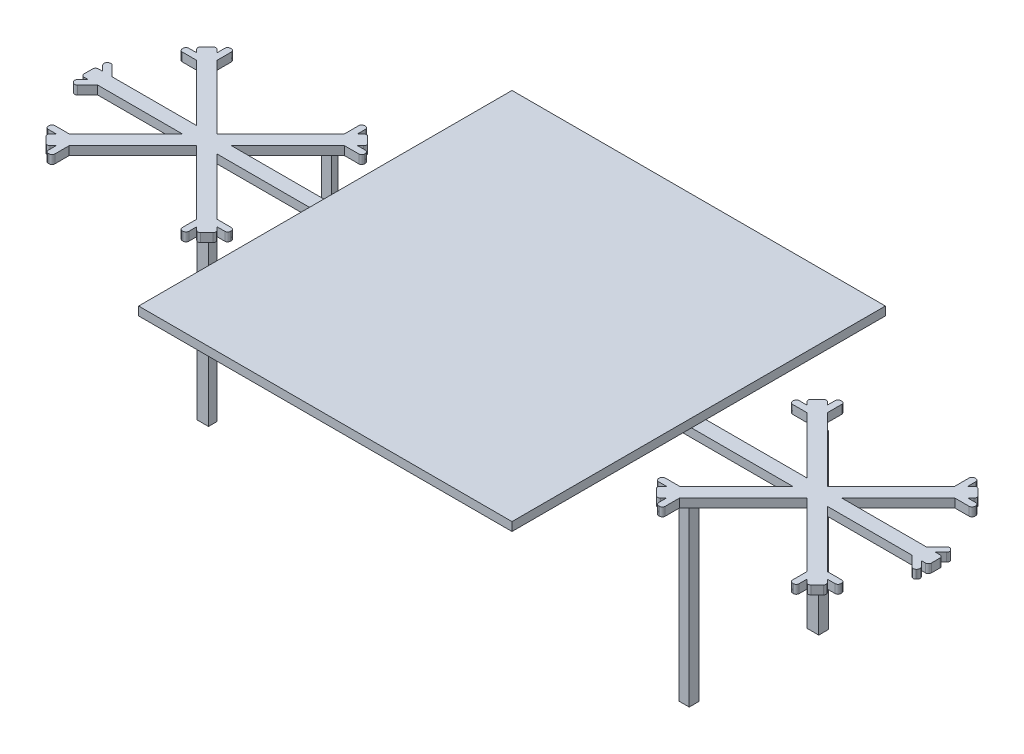
from build123d import *

# Parameters (mm, degrees)
SKETCH1_W           = 130
SKETCH1_H           = 130
BOSS_EXTRUDE1_DEPTH = 3
BOSS_EXTRUDE3_DEPTH = 3
FILLET1_R           = 1
SKETCH3_W           = 3.967271972
SKETCH3_H           = 2.96123903
SKETCH3_W_2         = 3.45962134
SKETCH3_H_2         = 2.230935605
SKETCH3_W_3         = 4.08664758
SKETCH3_H_3         = 3.34080174
SKETCH3_W_4         = 3.481915156
SKETCH3_H_4         = 3.338822753
BOSS_EXTRUDE4_DEPTH = 60


with BuildPart() as part:
    # Sketch1 → Boss-Extrude1 (new body)
    with BuildSketch(Plane(origin=(0, 0, 0), x_dir=(1, 0, 0), z_dir=(0, 1, 0))):
        Rectangle(SKETCH1_W, SKETCH1_H)
    extrude(amount=BOSS_EXTRUDE1_DEPTH)

    # Sketch2 → Boss-Extrude3 (add)
    with BuildSketch(Plane.XZ):
        Polygon((-147.5, 2.5), (-147.5, -2.5), (-145, -2.5), (-147.630437226, -5.130437226), (-146.018233765, -6.742640687), (-141.775593078, -2.5), (-112.285533906, -2.5), (-131.97245322, -22.186919314), (-137.97245322, -22.186919314), (-137.97245322, -24.464744197), (-134.250278103, -24.464744197), (-136.018045056, -26.23251115), (-132.48251115, -29.768045056), (-130.714744197, -28.000278103), (-130.714744197, -31.72245322), (-128.436919314, -31.72245322), (-128.436919314, -25.72245322), (-106.25, -3.535533906), (-84.063080686, -25.72245322), (-84.063080686, -31.72245322), (-81.785255803, -31.72245322), (-81.785255803, -28.000278103), (-80.01748885, -29.768045056), (-76.481954944, -26.23251115), (-78.249721897, -24.464744197), (-74.52754678, -24.464744197), (-74.52754678, -22.186919314), (-80.52754678, -22.186919314), (-100.214466094, -2.5), (100.214466094, -2.5), (80.52754678, -22.186919314), (74.52754678, -22.186919314), (74.52754678, -24.464744197), (78.249721897, -24.464744197), (76.481954944, -26.23251115), (80.01748885, -29.768045056), (81.785255803, -28.000278103), (81.785255803, -31.72245322), (84.063080686, -31.72245322), (84.063080686, -25.72245322), (106.25, -3.535533906), (128.436919314, -25.72245322), (128.436919314, -31.72245322), (130.714744197, -31.72245322), (130.714744197, -28.000278103), (132.48251115, -29.768045056), (136.018045056, -26.23251115), (134.250278103, -24.464744197), (137.97245322, -24.464744197), (137.97245322, -22.186919314), (131.97245322, -22.186919314), (112.285533906, -2.5), (141.775593078, -2.5), (146.018233765, -6.742640687), (147.630437226, -5.130437226), (145, -2.5), (147.5, -2.5), (147.5, 2.5), (145, 2.5), (147.630437226, 5.130437226), (146.018233765, 6.742640687), (141.775593078, 2.5), (112.285533906, 2.5), (131.97245322, 22.186919314), (137.97245322, 22.186919314), (137.97245322, 24.464744197), (134.250278103, 24.464744197), (136.018045056, 26.23251115), (132.48251115, 29.768045056), (130.714744197, 28.000278103), (130.714744197, 31.72245322), (128.436919314, 31.72245322), (128.436919314, 25.72245322), (106.25, 3.535533906), (84.063080686, 25.72245322), (84.063080686, 31.72245322), (81.785255803, 31.72245322), (81.785255803, 28.000278103), (80.01748885, 29.768045056), (76.481954944, 26.23251115), (78.249721897, 24.464744197), (74.52754678, 24.464744197), (74.52754678, 22.186919314), (80.52754678, 22.186919314), (100.214466094, 2.5), (-100.214466094, 2.5), (-80.52754678, 22.186919314), (-74.52754678, 22.186919314), (-74.52754678, 24.464744197), (-78.249721897, 24.464744197), (-76.481954944, 26.23251115), (-80.01748885, 29.768045056), (-81.785255803, 28.000278103), (-81.785255803, 31.72245322), (-84.063080686, 31.72245322), (-84.063080686, 25.72245322), (-106.25, 3.535533906), (-128.436919314, 25.72245322), (-128.436919314, 31.72245322), (-130.714744197, 31.72245322), (-130.714744197, 28.000278103), (-132.48251115, 29.768045056), (-136.018045056, 26.23251115), (-134.250278103, 24.464744197), (-137.97245322, 24.464744197), (-137.97245322, 22.186919314), (-131.97245322, 22.186919314), (-112.285533906, 2.5), (-141.775593078, 2.5), (-146.018233765, 6.742640687), (-147.630437226, 5.130437226), (-145, 2.5), align=None)
    extrude(amount=BOSS_EXTRUDE3_DEPTH)

    # Fillet1
    fillet1_edges = [part.edges().sort_by_distance(p)[0] for p in [
        (-74.52754678, -1.5, -22.186919314),
        (-74.52754678, -1.5, -24.464744197),
        (-76.481954944, -1.5, -26.23251115),
        (-80.01748885, -1.5, -29.768045056),
        (-81.785255803, -1.5, -31.72245322),
        (-84.063080686, -1.5, -31.72245322),
        (-74.52754678, -1.5, 22.186919314),
        (-74.52754678, -1.5, 24.464744197),
        (-76.481954944, -1.5, 26.23251115),
        (-80.01748885, -1.5, 29.768045056),
        (-81.785255803, -1.5, 31.72245322),
        (-84.063080686, -1.5, 31.72245322),
        (-128.436919314, -1.5, 31.72245322),
        (-130.714744197, -1.5, 31.72245322),
        (-132.48251115, -1.5, 29.768045056),
        (-136.018045056, -1.5, 26.23251115),
        (-137.97245322, -1.5, 22.186919314),
        (-137.97245322, -1.5, 24.464744197),
        (-128.436919314, -1.5, -31.72245322),
        (-130.714744197, -1.5, -31.72245322),
        (-132.48251115, -1.5, -29.768045056),
        (-136.018045056, -1.5, -26.23251115),
        (-137.97245322, -1.5, -24.464744197),
        (-137.97245322, -1.5, -22.186919314),
        (-146.018233765, -1.5, 6.742640687),
        (-147.630437226, -1.5, 5.130437226),
        (-147.5, -1.5, 2.5),
        (-147.5, -1.5, -2.5),
        (-147.630437226, -1.5, -5.130437226),
        (-146.018233765, -1.5, -6.742640687),
        (84.063080686, -1.5, -31.72245322),
        (81.785255803, -1.5, -31.72245322),
        (80.01748885, -1.5, -29.768045056),
        (76.481954944, -1.5, -26.23251115),
        (74.52754678, -1.5, -22.186919314),
        (74.52754678, -1.5, -24.464744197),
        (74.52754678, -1.5, 22.186919314),
        (74.52754678, -1.5, 24.464744197),
        (76.481954944, -1.5, 26.23251115),
        (80.01748885, -1.5, 29.768045056),
        (84.063080686, -1.5, 31.72245322),
        (81.785255803, -1.5, 31.72245322),
        (128.436919314, -1.5, 31.72245322),
        (130.714744197, -1.5, 31.72245322),
        (132.48251115, -1.5, 29.768045056),
        (136.018045056, -1.5, 26.23251115),
        (137.97245322, -1.5, 24.464744197),
        (137.97245322, -1.5, 22.186919314),
        (146.018233765, -1.5, 6.742640687),
        (147.630437226, -1.5, 5.130437226),
        (147.5, -1.5, 2.5),
        (147.5, -1.5, -2.5),
        (147.630437226, -1.5, -5.130437226),
        (146.018233765, -1.5, -6.742640687),
        (137.97245322, -1.5, -22.186919314),
        (137.97245322, -1.5, -24.464744197),
        (136.018045056, -1.5, -26.23251115),
        (132.48251115, -1.5, -29.768045056),
        (130.714744197, -1.5, -31.72245322),
        (128.436919314, -1.5, -31.72245322),
    ]]
    fillet(fillet1_edges, radius=FILLET1_R)

    # Sketch3 → Boss-Extrude4 (add)
    with BuildSketch(Plane.XZ.offset(3)):
        with Locations((-84.491523849, 21.687197746)):
            Rectangle(SKETCH3_W, SKETCH3_H)
        with Locations((-84.491523849, -21.068220718)):
            Rectangle(SKETCH3_W_2, SKETCH3_H_2)
        with Locations((84.599323341, -21.828867413)):
            Rectangle(SKETCH3_W_3, SKETCH3_H_3)
        with Locations((84.050158455, 22.420317733)):
            Rectangle(SKETCH3_W_4, SKETCH3_H_4)
    extrude(amount=BOSS_EXTRUDE4_DEPTH)


solid = part.part
